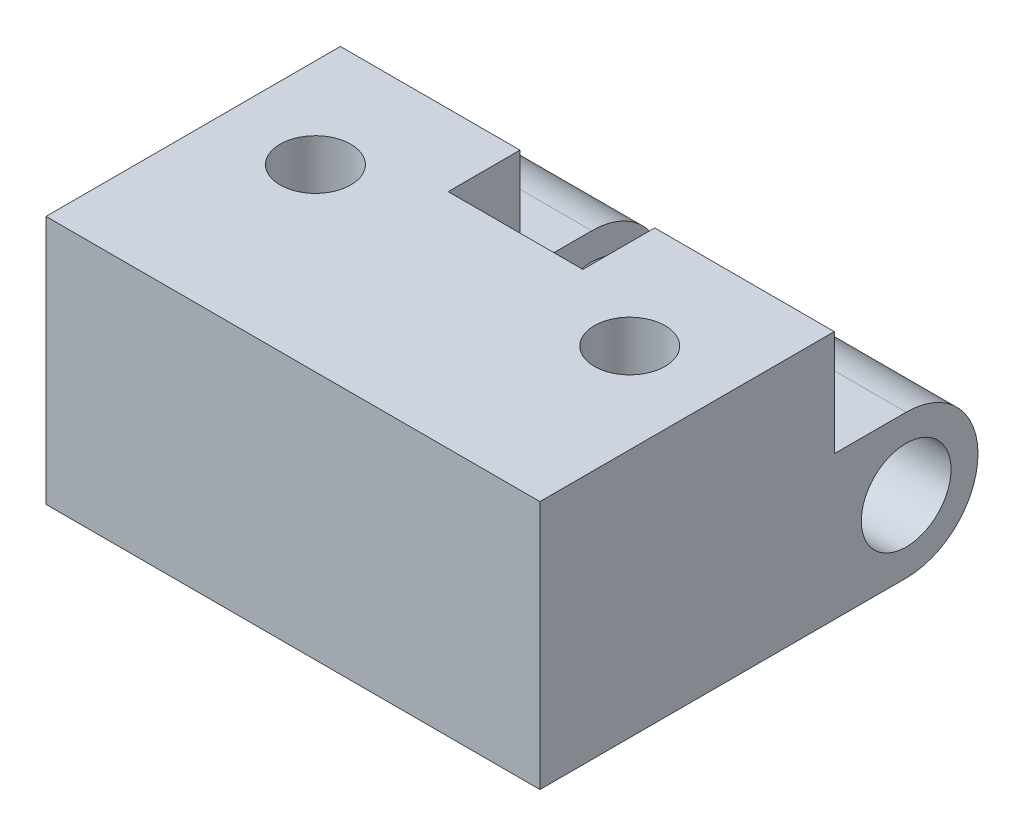
from build123d import *

# Parameters (mm, degrees)
SKETCH2_R           = 1.5875
BOSS_EXTRUDE1_DEPTH = 6.35
CUT_EXTRUDE1_DEPTH  = 10
BOSS_EXTRUDE2_DEPTH = 4.7625
BOSS_EXTRUDE3_DEPTH = 3.73750002
SKETCH7_R           = 1.25
CUT_EXTRUDE2_DEPTH  = 21.353004305


with BuildPart() as part:
    # Sketch2 → Boss-Extrude1 (new body)
    with BuildSketch(Plane(origin=(0, 0, 0), x_dir=(0, 0, -1), z_dir=(1, 0, 0))):
        with BuildLine():
            Line((6.597804878, 5.08), (-6.35, 5.08))
            Line((-6.35, 5.08), (-6.35, 0))
            Line((-6.35, 0), (6.597804878, 0))
            ThreePointArc((6.597804878, 0), (9.137804878, 2.54), (6.597804878, 5.08))
        make_face()
        with Locations((6.597804878, 2.54)):
            Circle(SKETCH2_R, mode=Mode.SUBTRACT)
    boss_extrude1 = extrude(amount=BOSS_EXTRUDE1_DEPTH)

    # Sketch3 → Cut-Extrude1 (cut)
    with BuildSketch(Plane(origin=(0, 5.08, 0), x_dir=(1, 0, 0), z_dir=(0, 1, 0))):
        with BuildLine():
            ThreePointArc((3.175, -1.5), (4.235660172, -1.060660172), (4.675, 0))
            ThreePointArc((4.675, 0), (2.114339828, 1.060660172), (3.175, -1.5))
        make_face()
    cut_extrude1 = extrude(amount=-CUT_EXTRUDE1_DEPTH, mode=Mode.SUBTRACT)

    # Sketch4 → Boss-Extrude2 (add)
    with BuildSketch(Plane(origin=(6.35, 0, 0), x_dir=(0, 0, -1), z_dir=(1, 0, 0))):
        Polygon((-6.35, 0), (1.517804878, 0), (1.517804878, 2.54), (1.517804878, 5.08), (-6.35, 5.08), align=None)
    extrude(amount=BOSS_EXTRUDE2_DEPTH)

    # Mirror1: Boss-Extrude1, Cut-Extrude1 across plane
    add(boss_extrude1.mirror(Plane(origin=(8.73125, 0, 0), x_dir=(0, 0, 1), z_dir=(1, 0, 0))))
    add(cut_extrude1.mirror(Plane(origin=(8.73125, 0, 0), x_dir=(0, 0, 1), z_dir=(1, 0, 0))), mode=Mode.SUBTRACT)

    # Sketch6 → Boss-Extrude3 (add)
    with BuildSketch(Plane(origin=(0, 5.08, 0), x_dir=(1, 0, 0), z_dir=(0, 1, 0))):
        Polygon((6.35, 4.057804878), (0, 4.057804878), (0, -6.35), (17.4625, -6.35), (17.4625, 4.057804878), (11.1125, 4.057804878), (11.1125, 1.517804878), (6.35, 1.517804878), align=None)
    extrude(amount=BOSS_EXTRUDE3_DEPTH)

    # Sketch7 → Cut-Extrude2 (cut, through all)
    with BuildSketch(Plane.XZ.offset(-5.08)):
        with Locations((14.2875, 0)):
            Circle(SKETCH7_R)
        with Locations((3.175, 0)):
            Circle(SKETCH7_R)
    extrude(amount=-CUT_EXTRUDE2_DEPTH, mode=Mode.SUBTRACT)


solid = part.part
